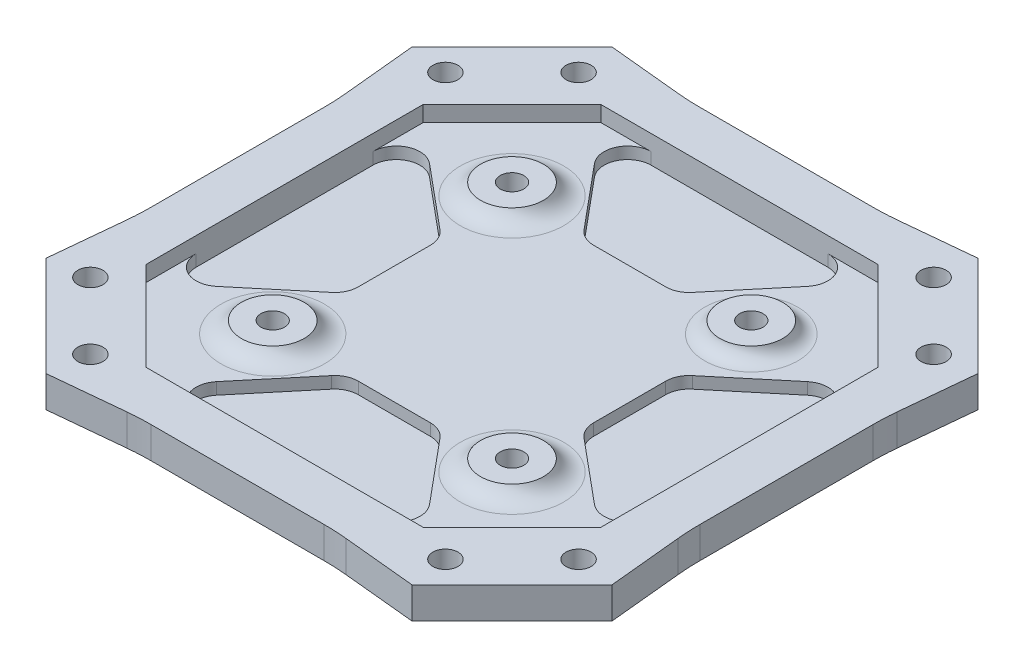
from build123d import *

# Parameters (mm, degrees)
SKETCH1_R           = 1.6
BOSS_EXTRUDE1_DEPTH = 4
CUT_EXTRUDE1_DEPTH  = 2
CUT_EXTRUDE2_DEPTH  = 1.5
SKETCH5_R           = 4
BOSS_EXTRUDE2_DEPTH = 1.5
SKETCH8_R           = 1.5
CUT_EXTRUDE3_DEPTH  = 52.119956964
CIRPATTERN1_COUNT   = 4
FILLET1_R           = 3
FILLET1_R_2         = 2
FILLET2_R           = 30


with BuildPart() as part:
    # Sketch1 → Boss-Extrude1 (new body)
    with BuildSketch(Plane(origin=(0, 0, 0), x_dir=(1, 0, 0), z_dir=(0, 1, 0))):
        Polygon((12.5, 35), (-12.5, 35), (-23.334523779, 36.062445841), (-36.062445841, 23.334523779), (-35, 12.5), (-35, -12.5), (-36.062445841, -23.334523779), (-23.334523779, -36.062445841), (-12.5, -35), (12.5, -35), (23.334523779, -36.062445841), (36.062445841, -23.334523779), (35, -12.5), (35, 12.5), (36.062445841, 23.334523779), (23.334523779, 36.062445841), align=None)
        with Locations(Location((22.627416998, 31.112698372, 0), (0, 0, 270))):
            Circle(SKETCH1_R, mode=Mode.SUBTRACT)
        with Locations(Location((31.112698372, 22.627416998, 0), (0, 0, 270))):
            Circle(SKETCH1_R, mode=Mode.SUBTRACT)
        with Locations(Location((22.627416998, -31.112698372, 0), (0, 0, 270))):
            Circle(SKETCH1_R, mode=Mode.SUBTRACT)
        with Locations(Location((31.112698372, -22.627416998, 0), (0, 0, 270))):
            Circle(SKETCH1_R, mode=Mode.SUBTRACT)
        with Locations(Location((-31.112698372, -22.627416998, 0), (0, 0, 270))):
            Circle(SKETCH1_R, mode=Mode.SUBTRACT)
        with Locations(Location((-22.627416998, -31.112698372, 0), (0, 0, 270))):
            Circle(SKETCH1_R, mode=Mode.SUBTRACT)
        with Locations(Location((-22.627416998, 31.112698372, 0), (0, 0, 270))):
            Circle(SKETCH1_R, mode=Mode.SUBTRACT)
        with Locations(Location((-31.112698372, 22.627416998, 0), (0, 0, 270))):
            Circle(SKETCH1_R, mode=Mode.SUBTRACT)
    extrude(amount=BOSS_EXTRUDE1_DEPTH)

    # Sketch2 → Cut-Extrude1 (cut)
    with BuildSketch(Plane(origin=(0, 4, 0), x_dir=(1, 0, 0), z_dir=(0, 1, 0))):
        Polygon((-17.669047558, 29), (17.669047558, 29), (29, 17.669047558), (29, -17.669047558), (17.669047558, -29), (-17.669047558, -29), (-29, -17.669047558), (-29, 17.669047558), align=None)
    extrude(amount=-CUT_EXTRUDE1_DEPTH, mode=Mode.SUBTRACT)

    # Sketch4 → Cut-Extrude2 (cut)
    with BuildSketch(Plane(origin=(0, 2, 0), x_dir=(1, 0, 0), z_dir=(0, 1, 0))):
        with BuildLine():
            Line((-24.079215521, 13.567556979), (-16.079215521, 6.899529803))
            ThreePointArc((-16.079215521, 6.899529803), (-15.283167889, 5.867388581), (-15, 4.595058717))
            Line((-15, 4.595058717), (-15, -4.595058717))
            ThreePointArc((-15, -4.595058717), (-15.283167889, -5.867388581), (-16.079215521, -6.899529803))
            Line((-16.079215521, -6.899529803), (-24.079215521, -13.567556979))
            ThreePointArc((-24.079215521, -13.567556979), (-27.272329864, -13.979918004), (-29, -11.263085893))
            Line((-29, -11.263085893), (-29, 11.263085893))
            ThreePointArc((-29, 11.263085893), (-27.272329864, 13.979918004), (-24.079215521, 13.567556979))
        make_face()
        with BuildLine():
            Line((-11.263085893, 29), (11.263085893, 29))
            ThreePointArc((11.263085893, 29), (13.979918004, 27.272329864), (13.567556979, 24.079215521))
            Line((13.567556979, 24.079215521), (6.899529803, 16.079215521))
            ThreePointArc((6.899529803, 16.079215521), (5.867388581, 15.283167889), (4.595058717, 15))
            Line((4.595058717, 15), (-4.595058717, 15))
            ThreePointArc((-4.595058717, 15), (-5.867388581, 15.283167889), (-6.899529803, 16.079215521))
            Line((-6.899529803, 16.079215521), (-13.567556979, 24.079215521))
            ThreePointArc((-13.567556979, 24.079215521), (-13.979918004, 27.272329864), (-11.263085893, 29))
        make_face()
        with BuildLine():
            Line((29, 11.263085893), (29, -11.263085893))
            ThreePointArc((29, -11.263085893), (27.272329864, -13.979918004), (24.079215521, -13.567556979))
            Line((24.079215521, -13.567556979), (16.079215521, -6.899529803))
            ThreePointArc((16.079215521, -6.899529803), (15.283167889, -5.867388581), (15, -4.595058717))
            Line((15, -4.595058717), (15, 4.595058717))
            ThreePointArc((15, 4.595058717), (15.283167889, 5.867388581), (16.079215521, 6.899529803))
            Line((16.079215521, 6.899529803), (24.079215521, 13.567556979))
            ThreePointArc((24.079215521, 13.567556979), (27.272329864, 13.979918004), (29, 11.263085893))
        make_face()
        with BuildLine():
            Line((11.263085893, -29), (-11.263085893, -29))
            ThreePointArc((-11.263085893, -29), (-13.979918004, -27.272329864), (-13.567556979, -24.079215521))
            Line((-13.567556979, -24.079215521), (-6.899529803, -16.079215521))
            ThreePointArc((-6.899529803, -16.079215521), (-5.867388581, -15.283167889), (-4.595058717, -15))
            Line((-4.595058717, -15), (4.595058717, -15))
            ThreePointArc((4.595058717, -15), (5.867388581, -15.283167889), (6.899529803, -16.079215521))
            Line((6.899529803, -16.079215521), (13.567556979, -24.079215521))
            ThreePointArc((13.567556979, -24.079215521), (13.979918004, -27.272329864), (11.263085893, -29))
        make_face()
    extrude(amount=-CUT_EXTRUDE2_DEPTH, mode=Mode.SUBTRACT)

    # Sketch5 → Boss-Extrude2 (add)
    with BuildSketch(Plane(origin=(0, 2, 0), x_dir=(1, 0, 0), z_dir=(0, 1, 0))):
        with Locations(Location((15.25, 15.25, 0), (0, 0, 90))):
            Circle(SKETCH5_R)
    boss_extrude2 = extrude(amount=BOSS_EXTRUDE2_DEPTH)

    # Sketch8 → Cut-Extrude3 (cut, through all)
    with BuildSketch(Plane(origin=(0, 3.5, 0), x_dir=(1, 0, 0), z_dir=(0, 1, 0))):
        with Locations(Location((15.25, 15.25, 0), (0, 0, 270))):
            Circle(SKETCH8_R)
    cut_extrude3 = extrude(amount=-CUT_EXTRUDE3_DEPTH, mode=Mode.SUBTRACT)

    # CirPattern1: Boss-Extrude2, Cut-Extrude3 ×4 about axis
    cirpattern1_axis = Axis((0, 0, 0), (0, 1, 0))
    add([boss_extrude2.rotate(cirpattern1_axis, i * 360 / CIRPATTERN1_COUNT) for i in range(1, CIRPATTERN1_COUNT)])
    add([cut_extrude3.rotate(cirpattern1_axis, i * 360 / CIRPATTERN1_COUNT) for i in range(1, CIRPATTERN1_COUNT)], mode=Mode.SUBTRACT)

    # Fillet1
    # the kernel refuses this fillet: 3, 2 mm, written as the material it adds along each edge
    with BuildSketch(Plane(origin=(-15.25, 2, -15.25), x_dir=(-1, 0, 0), z_dir=(0, 0, -1))) as fillet1_piece_1:
        with BuildLine():
            CenterArc((6.598076211, 3), FILLET1_R, 210, 60)
            Line((4, 1.5), (3.948038476, 1.47))
            ThreePointArc((3.948038476, 1.47), (3.94, 0.75), (3.94, 0))
            Line((3.94, 0), (4, -0.06))
            Line((4, -0.06), (6.598076211, -0.06))
            Line((6.598076211, -0.06), (6.598076211, 0))
        make_face()
    revolve(axis=Axis((-15.25, 2, -15.25), (0, 1, 0)))
    with BuildSketch(Plane(origin=(-15.25, 2, 15.25), x_dir=(0, 0, 1), z_dir=(-1, 0, 0))) as fillet1_piece_2:
        with BuildLine():
            CenterArc((6.598076211, 3), FILLET1_R, 210, 60)
            Line((4, 1.5), (3.948038476, 1.47))
            ThreePointArc((3.948038476, 1.47), (3.94, 0.75), (3.94, 0))
            Line((3.94, 0), (4, -0.06))
            Line((4, -0.06), (6.598076211, -0.06))
            Line((6.598076211, -0.06), (6.598076211, 0))
        make_face()
    revolve(axis=Axis((-15.25, 2, 15.25), (0, 1, 0)))
    with BuildSketch(Plane(origin=(15.25, 2, 15.25), x_dir=(1, 0, 0), z_dir=(0, 0, 1))) as fillet1_piece_3:
        with BuildLine():
            CenterArc((6.598076211, 3), FILLET1_R, 210, 60)
            Line((4, 1.5), (3.948038476, 1.47))
            ThreePointArc((3.948038476, 1.47), (3.94, 0.75), (3.94, 0))
            Line((3.94, 0), (4, -0.06))
            Line((4, -0.06), (6.598076211, -0.06))
            Line((6.598076211, -0.06), (6.598076211, 0))
        make_face()
    revolve(axis=Axis((15.25, 2, 15.25), (0, 1, 0)))
    with BuildSketch(Plane(origin=(15.25, 2, -15.25), x_dir=(0, 0, -1), z_dir=(1, 0, 0))) as fillet1_piece_4:
        with BuildLine():
            CenterArc((5.936491673, 2), FILLET1_R_2, 194.477512186, 75.522487814)
            Line((4, 1.5), (3.961270167, 1.49))
            ThreePointArc((3.961270167, 1.49), (3.96, 0.75), (3.96, 0))
            Line((3.96, 0), (4, -0.04))
            Line((4, -0.04), (5.936491673, -0.04))
            Line((5.936491673, -0.04), (5.936491673, 0))
        make_face()
    revolve(axis=Axis((15.25, 2, -15.25), (0, 1, 0)))

    # Fillet2
    # the kernel refuses this fillet: 30 mm, written as the material it adds along each edge
    with BuildSketch(Plane(origin=(-12.5, 0, -35), x_dir=(1, 0, 0), z_dir=(0, 1, 0)), Plane(origin=(-12.5, 0, 35), x_dir=(-0.9952264052892464, 0, 0.09759304388656438), z_dir=(0, 1, 0)), Plane(origin=(-35, 0, 12.5), x_dir=(0, 0, -1), z_dir=(0, 1, 0)), Plane(origin=(-35, 0, -12.5), x_dir=(-0.09759304388656037, 0, -0.9952264052892466), z_dir=(0, 1, 0))) as fillet2_piece_1:
        with BuildLine():
            CenterArc((FILLET2_R * 0.0489132680017, FILLET2_R), FILLET2_R, 264.399415997, 5.600584003)
            Line((-FILLET2_R * 0.0486797758843, FILLET2_R * 0.0047735947107), (0, 0))
            Line((0, 0), (FILLET2_R * 0.0489132680017, 0))
        make_face()
    extrude(amount=4)
    with BuildSketch(Plane(origin=(12.5, 0, -35), x_dir=(-1, 0, 0), z_dir=(0, 1, 0)), Plane(origin=(35, 0, -12.5), x_dir=(0.09759304388597856, 0, -0.9952264052893037), z_dir=(0, 1, 0)), Plane(origin=(35, 0, 12.5), x_dir=(0, 0, -1), z_dir=(0, 1, 0)), Plane(origin=(12.5, 0, 35), x_dir=(0.9952264052893038, 0, 0.09759304388597881), z_dir=(0, 1, 0))) as fillet2_piece_2:
        with BuildLine():
            CenterArc((FILLET2_R * 0.048913268002, -FILLET2_R), FILLET2_R, 90, 5.600584003)
            Line((-FILLET2_R * 0.0486797758846, -FILLET2_R * 0.00477359471075), (0, 0))
            Line((0, 0), (FILLET2_R * 0.048913268002, 0))
        make_face()
    extrude(amount=4)


solid = part.part
